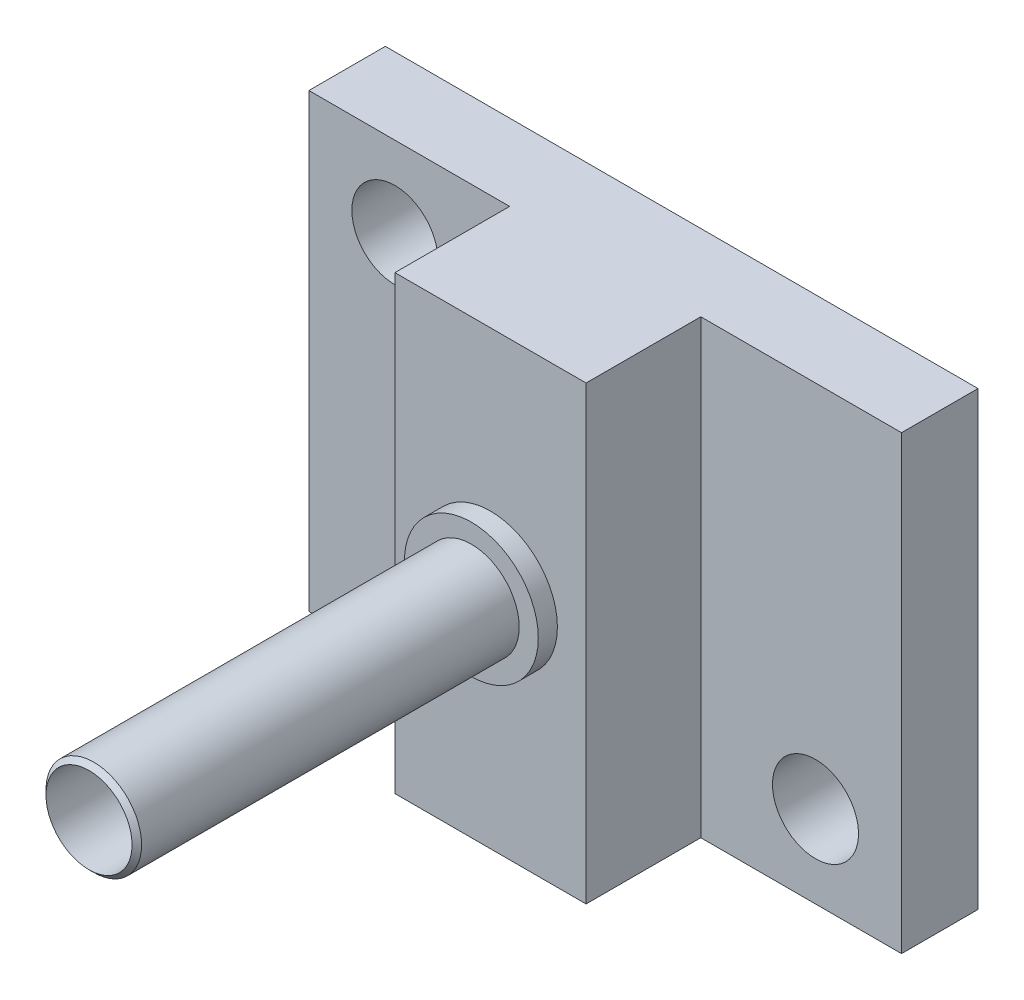
from build123d import *

# Parameters (mm, degrees)
SKETCH1_R           = 8.5
BOSS_EXTRUDE1_DEPTH = 1
SKETCH2_W           = 31
SKETCH2_H           = 23.6
BOSS_EXTRUDE2_DEPTH = 4
SKETCH3_W           = 10
SKETCH3_H           = 23.6
BOSS_EXTRUDE3_DEPTH = 6
SKETCH4_R           = 3.5
BOSS_EXTRUDE4_DEPTH = 1
SKETCH5_R           = 2.5
BOSS_EXTRUDE5_DEPTH = 20.25
SKETCH7_R           = 2.25
CUT_EXTRUDE1_DEPTH  = 12
SKETCH8_R           = 2.25
CUT_EXTRUDE2_DEPTH  = 50.945194964
CHAMFER1_SIZE       = 0.5


with BuildPart() as part:
    # Sketch1 → Boss-Extrude1 (new body)
    with BuildSketch(Plane.XY):
        with Locations((15.5, 11.8)):
            Circle(SKETCH1_R)
    extrude(amount=BOSS_EXTRUDE1_DEPTH)

    # Sketch2 → Boss-Extrude2 (add)
    with BuildSketch(Plane.XY.offset(1)):
        with Locations((15.5, 11.8)):
            Rectangle(SKETCH2_W, SKETCH2_H)
    extrude(amount=BOSS_EXTRUDE2_DEPTH)

    # Sketch3 → Boss-Extrude3 (add)
    with BuildSketch(Plane.XY.offset(5)):
        with Locations((15.5, 11.8)):
            Rectangle(SKETCH3_W, SKETCH3_H)
    extrude(amount=BOSS_EXTRUDE3_DEPTH)

    # Sketch4 → Boss-Extrude4 (add)
    with BuildSketch(Plane.XY.offset(11)):
        with Locations((15.5, 11.8)):
            Circle(SKETCH4_R)
    extrude(amount=BOSS_EXTRUDE4_DEPTH)

    # Sketch5 → Boss-Extrude5 (add)
    with BuildSketch(Plane.XY.offset(12)):
        with Locations((15.5, 11.8)):
            Circle(SKETCH5_R)
    extrude(amount=BOSS_EXTRUDE5_DEPTH)

    # Sketch7 → Cut-Extrude1 (cut)
    with BuildSketch(Plane.XY.offset(32.25)):
        with Locations((15.5, 11.8)):
            Circle(SKETCH7_R)
    extrude(amount=-CUT_EXTRUDE1_DEPTH, mode=Mode.SUBTRACT)

    # Sketch8 → Cut-Extrude2 (cut, through all)
    with BuildSketch(Plane(origin=(0, 0, 1), x_dir=(-1, 0, 0), z_dir=(0, 0, -1))):
        with Locations((-26.5, 4.3)):
            Circle(SKETCH8_R)
        with Locations((-4.5, 19.3)):
            Circle(SKETCH8_R)
    extrude(amount=-CUT_EXTRUDE2_DEPTH, mode=Mode.SUBTRACT)

    # Chamfer1
    # the kernel refuses this chamfer: 0.5 mm, written as the material it takes off along each edge
    with BuildSketch(Plane(origin=(15.5, 11.8, 32.25), x_dir=(1, 0, 0), z_dir=(0, -1, 0))) as chamfer1_piece_1:
        Polygon((2.5, -CHAMFER1_SIZE), (2.5 - CHAMFER1_SIZE, 0), (2.5, 0), align=None)
    revolve(axis=Axis((15.5, 11.8, 32.25), (0, 0, 1)), mode=Mode.SUBTRACT)


solid = part.part
